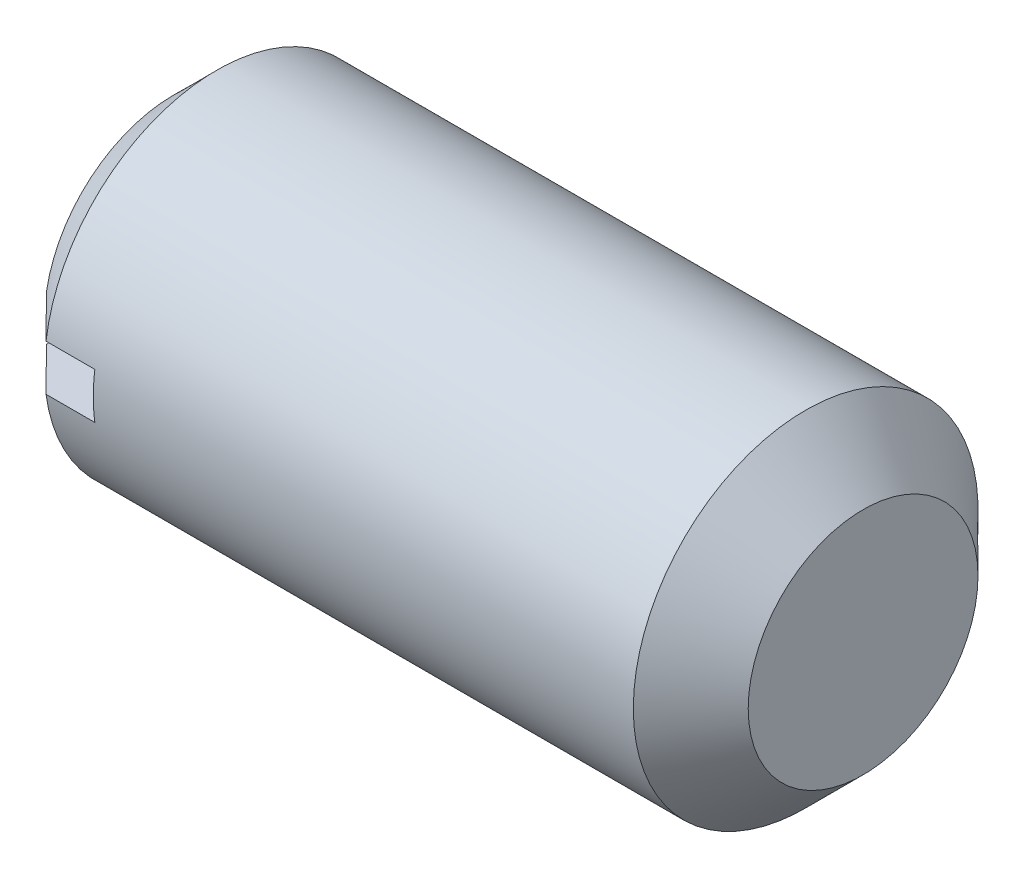
from build123d import *

# Parameters (mm, degrees)
NOTCH_DEPTH      = 7.363961031
NOTCH_DEPTH_BACK = 7.363961031
SKETCH2_W        = 0.8
SKETCH2_H        = 0.4


with BuildPart() as part:
    # Sketch1 → Base (revolve)
    with BuildSketch(Plane.XY):
        Polygon((0, 0), (6, 0), (6, 1), (5.5, 1.5), (0.375, 1.5), (0, 1.125), align=None)
    revolve(axis=Axis((-10.745014543, 0, 0), (1, 0, 0)))

    # Sketch2 → Notch (cut, two sides: drawn at the far end of the back side and taken through both)
    with BuildSketch(Plane.XY.offset(-NOTCH_DEPTH_BACK)):
        with Locations((0.4, 0)):
            Rectangle(SKETCH2_W, SKETCH2_H)
    extrude(amount=NOTCH_DEPTH + NOTCH_DEPTH_BACK, mode=Mode.SUBTRACT)


solid = part.part
